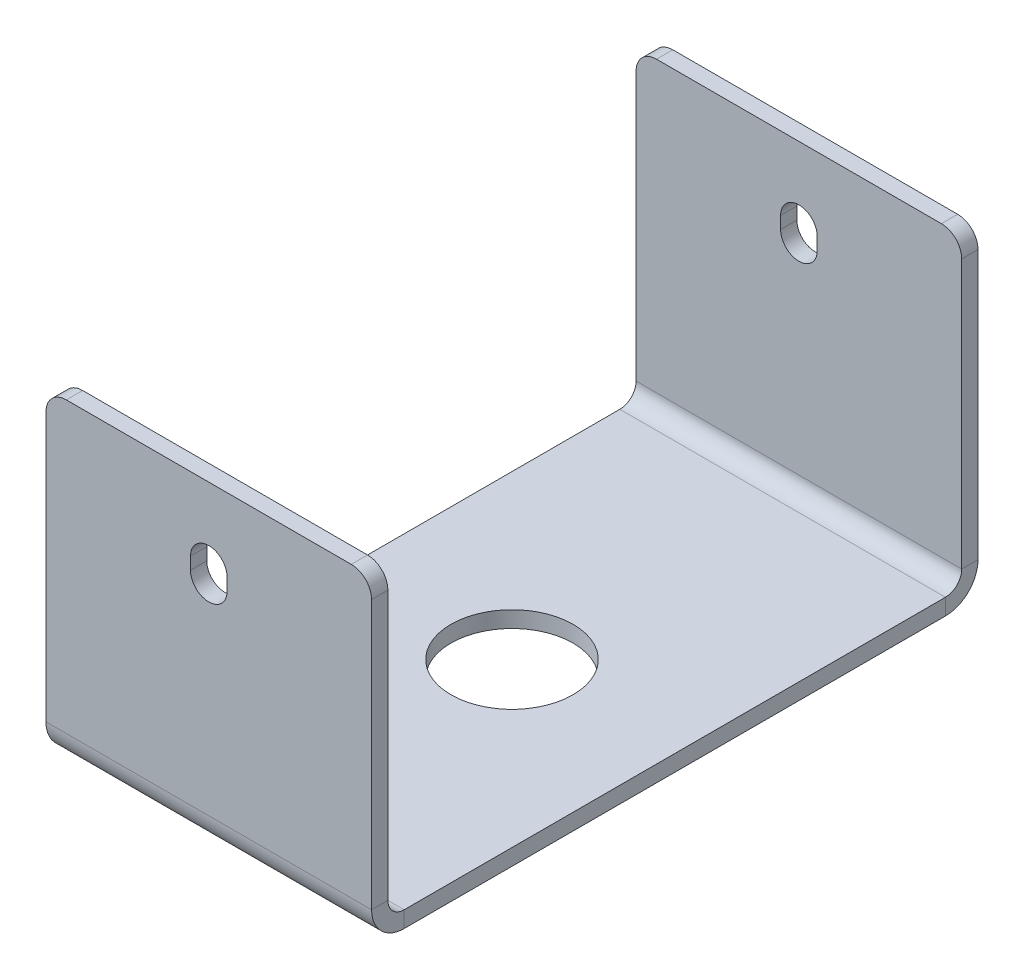
from build123d import *

# Parameters (mm, degrees)
SM_BASE_FLANGE_1_DEPTH = 40
CUT_EXTRUDE_1_REACH    = 117.721
SKETCH_6_R             = 15
CUT_EXTRUDE_2_DEPTH    = 172.54008278
FILLET_1_R             = 5


# Sheet-metal steps are written as plain solids
with BuildPart() as part:
    # Sketch 1 → 基体-法兰1 (new, symmetric)
    with BuildSketch(Plane(origin=(0, 0, 0), x_dir=(0, 0, -1), z_dir=(1, 0, 0))):
        with BuildLine():
            Line((-70.5, 75), (-70.5, 4))
            ThreePointArc((-70.5, 4), (-69.328427125, 1.171572875), (-66.5, 0))
            Line((-66.5, 0), (66.5, 0))
            ThreePointArc((66.5, 0), (69.328427125, 1.171572875), (70.5, 4))
            Line((70.5, 4), (70.5, 75))
            Line((70.5, 75), (74.5, 75))
            Line((74.5, 75), (74.5, 4))
            ThreePointArc((74.5, 4), (72.156854249, -1.656854249), (66.5, -4))
            Line((66.5, -4), (-66.5, -4))
            ThreePointArc((-66.5, -4), (-72.156854249, -1.656854249), (-74.5, 4))
            Line((-74.5, 4), (-74.5, 75))
            Line((-74.5, 75), (-70.5, 75))
        make_face()
    extrude(amount=SM_BASE_FLANGE_1_DEPTH, both=True)

    # 草图6 → 切除-拉伸1 (cut, up to next)
    with BuildSketch(Plane.XZ.offset(4), mode=Mode.PRIVATE) as cut_extrude_1_sk1:
        with Locations(Location((0, 0, 0), (0, 0, 270))):
            Circle(SKETCH_6_R)
    cut_extrude_1_tool1 = extrude(cut_extrude_1_sk1.sketch, amount=-CUT_EXTRUDE_1_REACH, mode=Mode.PRIVATE) & part.part
    add(cut_extrude_1_tool1.solids().sort_by_distance((0, -4, 0))[0], mode=Mode.SUBTRACT)

    # 草图7 → 切除-拉伸2 (cut, through all)
    with BuildSketch(Plane.XY.offset(74.5)):
        with BuildLine():
            Line((4.5, 57), (4.5, 54))
            ThreePointArc((4.5, 54), (0, 49.5), (-4.5, 54))
            Line((-4.5, 54), (-4.5, 57))
            ThreePointArc((-4.5, 57), (0, 61.5), (4.5, 57))
        make_face()
    extrude(amount=-CUT_EXTRUDE_2_DEPTH, mode=Mode.SUBTRACT)

    # 圆角1
    fillet_1_edges = [part.edges().sort_by_distance(p)[0] for p in [
        (-40, 75, 72.5),
        (-40, 75, -72.5),
        (40, 75, 72.5),
        (40, 75, -72.5),
    ]]
    fillet(fillet_1_edges, radius=FILLET_1_R)


solid = part.part
